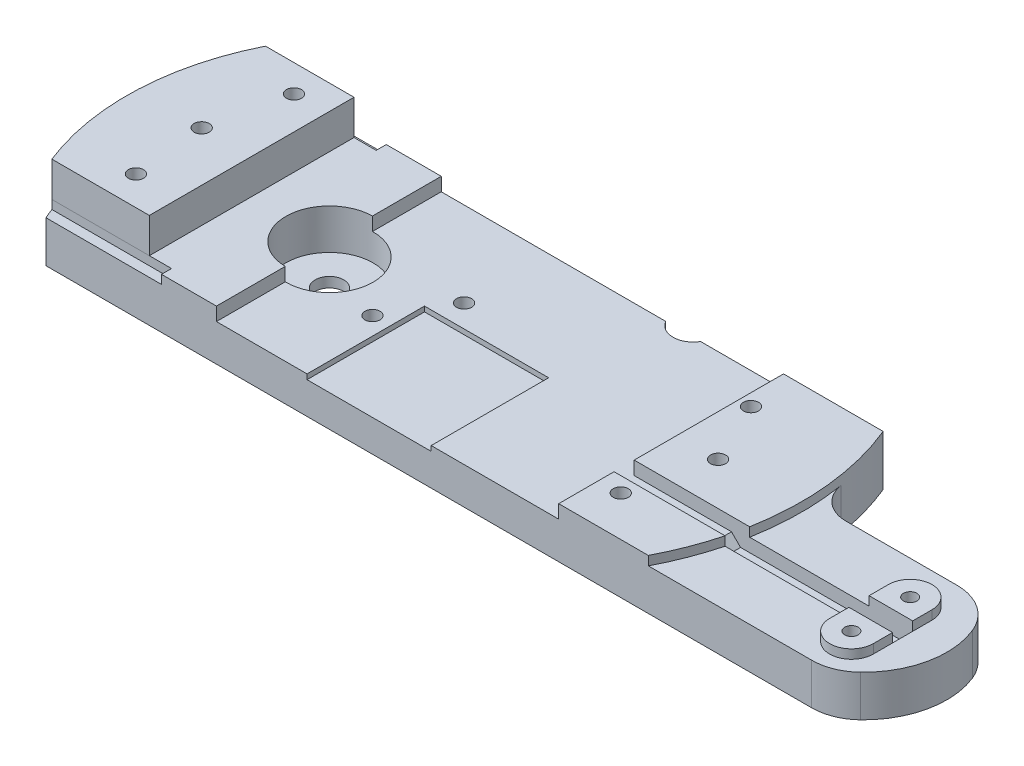
from build123d import *

# Parameters (mm, degrees)
SKETCH1_W           = 195
SKETCH1_H           = 67
BOSS_EXTRUDE1_DEPTH = 25.4
CUT_EXTRUDE1_DEPTH  = 107.177492907
CUT_EXTRUDE2_DEPTH  = 121.997561959
CUT_EXTRUDE3_START  = -13
SKETCH4_W           = 6.612655346
SKETCH4_H           = 3
CUT_EXTRUDE3_DEPTH  = 13
SKETCH6_R           = 2.25
CUT_EXTRUDE4_DEPTH  = 107.177492907
SKETCH7_W           = 37
SKETCH7_H           = 35
CUT_EXTRUDE5_DEPTH  = 1.5
CUT_EXTRUDE6_DEPTH  = 18.5
SKETCH9_R           = 2
BOSS_EXTRUDE2_DEPTH = 12.3
FILLET1_R           = 10
CUT_EXTRUDE7_REACH  = 165.895
CUT_EXTRUDE7_START  = -3
SKETCH10_R          = 13
SKETCH13_R          = 4.25
CUT_EXTRUDE9_DEPTH  = 161.89488962
SKETCH11_R          = 2
BOSS_EXTRUDE3_DEPTH = 2.7
CUT_EXTRUDE8_DEPTH  = 6


# Read off the part's stored shape, not the designer's step: Split1
with BuildPart() as part:
    # Sketch1 → Boss-Extrude1 (new body)
    with BuildSketch(Plane(origin=(0, 0, 0), x_dir=(1, 0, 0), z_dir=(0, 1, 0))):
        Rectangle(SKETCH1_W, SKETCH1_H)
    extrude(amount=BOSS_EXTRUDE1_DEPTH)

    # Sketch2 → Cut-Extrude1 (cut, through all)
    with BuildSketch(Plane.XZ):
        with BuildLine():
            Line((97.5, -3.219751644), (97.5, 33.5))
            Line((97.5, 33.5), (88.5, 33.5))
            ThreePointArc((88.5, 33.5), (95.217186872, 15.683556008), (97.5, -3.219751644))
        make_face()
        with BuildLine():
            Line((97.5, -33.5), (97.5, -3.219751644))
            ThreePointArc((97.5, -3.219751644), (95.985558513, -18.65423771), (91.5, -33.5))
            Line((91.5, -33.5), (97.5, -33.5))
        make_face()
        with BuildLine():
            ThreePointArc((-88, -33.5), (-95.08607052, -15.861694529), (-97.5, 2.992884749))
            Line((-97.5, 2.992884749), (-97.5, -33.5))
            Line((-97.5, -33.5), (-88, -33.5))
        make_face()
        with BuildLine():
            ThreePointArc((-97.5, 2.992884749), (-95.856964648, 18.588830376), (-91, 33.5))
            Line((-91, 33.5), (-97.5, 33.5))
            Line((-97.5, 33.5), (-97.5, 2.992884749))
        make_face()
    extrude(amount=-CUT_EXTRUDE1_DEPTH, mode=Mode.SUBTRACT)

    # Sketch3 → Cut-Extrude2 (cut, through all)
    with BuildSketch(Plane(origin=(0, 0, 33.5), x_dir=(-1, 0, 0), z_dir=(0, 0, -1))):
        Polygon((63.2, 25.4), (63.2, 15), (40.2, 15), (40.2, 11), (-61.8, 11), (-61.8, 15), (-97.5, 15), (-97.5, 25.4), align=None)
    extrude(amount=CUT_EXTRUDE2_DEPTH, mode=Mode.SUBTRACT)

    # Sketch4 → Cut-Extrude3 (cut)
    with BuildSketch(Plane(origin=(0, 25.4, 0), x_dir=(1, 0, 0), z_dir=(0, 1, 0)).offset(CUT_EXTRUDE3_START)):
        with BuildLine():
            Line((-63.2, 30.5), (-63.2, 33.5))
            Line((-63.2, 33.5), (-88, 33.5))
            ThreePointArc((-88, 33.5), (-88.810680862, 32.008999469), (-89.587344654, 30.5))
            Line((-89.587344654, 30.5), (-63.2, 30.5))
        make_face()
        with Locations((-59.893672327, 32)):
            Rectangle(SKETCH4_W, SKETCH4_H)
        with BuildLine():
            Line((-63.2, -33.5), (-63.2, -30.5))
            Line((-63.2, -30.5), (-92.261692194, -30.5))
            ThreePointArc((-92.261692194, -30.5), (-91.647155152, -32.006859002), (-91, -33.5))
            Line((-91, -33.5), (-63.2, -33.5))
        make_face()
        with Locations((-59.893672327, -32)):
            Rectangle(SKETCH4_W, SKETCH4_H)
    extrude(amount=CUT_EXTRUDE3_DEPTH, mode=Mode.SUBTRACT)

    # Sketch6 → Cut-Extrude4 (cut, through all)
    with BuildSketch(Plane.XZ):
        with Locations(Location((-18.5, 8.7, 0), (0, 0, 270))):
            Circle(SKETCH6_R)
        with Locations(Location((74.1, -1.7, 0), (0, 0, 270))):
            Circle(SKETCH6_R)
        with Locations(Location((68.3, 21.5, 0), (0, 0, 270))):
            Circle(SKETCH6_R)
        with Locations(Location((65.4, -20.2, 0), (0, 0, 270))):
            Circle(SKETCH6_R)
        with Locations(Location((-8.1, -8.2, 0), (0, 0, 270))):
            Circle(SKETCH6_R)
        with Locations(Location((-75.9, 21.8, 0), (0, 0, 270))):
            Circle(SKETCH6_R)
        with Locations(Location((-78, 0.1, 0), (0, 0, 270))):
            Circle(SKETCH6_R)
        with Locations(Location((-73, -22.4, 0), (0, 0, 270))):
            Circle(SKETCH6_R)
    extrude(amount=-CUT_EXTRUDE4_DEPTH, mode=Mode.SUBTRACT)

    # Sketch7 → Cut-Extrude5 (cut)
    with BuildSketch(Plane(origin=(0, 11, 0), x_dir=(1, 0, 0), z_dir=(0, 1, 0))):
        with Locations((5.3, -16)):
            Rectangle(SKETCH7_W, SKETCH7_H)
    extrude(amount=-CUT_EXTRUDE5_DEPTH, mode=Mode.SUBTRACT)

    # Sketch8 → Cut-Extrude6 (cut)
    with BuildSketch(Plane(origin=(0, 25.4, 0), x_dir=(1, 0, 0), z_dir=(0, 1, 0))):
        with BuildLine():
            Line((37.096152423, 33.5), (31.9, 33.5))
            Line((31.9, 33.5), (31.9, 30.5))
            ThreePointArc((31.9, 30.5), (34.9, 31.303847577), (37.096152423, 33.5))
        make_face()
        with BuildLine():
            Line((31.9, 33.5), (26.703847577, 33.5))
            ThreePointArc((26.703847577, 33.5), (28.9, 31.303847577), (31.9, 30.5))
            Line((31.9, 30.5), (31.9, 33.5))
        make_face()
    extrude(amount=-CUT_EXTRUDE6_DEPTH, mode=Mode.SUBTRACT)

    # Sketch9 → Boss-Extrude2 (add)
    with BuildSketch(Plane.XZ):
        with BuildLine():
            Line((88.5, 33.5), (137.200361796, 33.5))
            ThreePointArc((137.200361796, 33.5), (142.769729546, 32.427747228), (147.542861296, 29.364285714))
            ThreePointArc((147.542861296, 29.364285714), (154.743476693, 16.527679502), (153.473750823, 1.864285714))
            ThreePointArc((153.473750823, 1.864285714), (147.953179578, -4.940573023), (139.572717606, -7.5))
            Line((139.572717606, -7.5), (97.384558849, -7.5))
            ThreePointArc((97.384558849, -7.5), (95.698800641, 13.597328658), (88.5, 33.5))
        make_face()
        with Locations(Location((138.3, 5.25, 0), (0, 0, 270))):
            Circle(SKETCH9_R, mode=Mode.SUBTRACT)
        with Locations(Location((138.3, 22.75, 0), (0, 0, 270))):
            Circle(SKETCH9_R, mode=Mode.SUBTRACT)
    extrude(amount=-BOSS_EXTRUDE2_DEPTH)

    # Fillet1
    fillet1_edges = [part.edges().sort_by_distance(p)[0] for p in [
        (97.384558849, 6.15, -7.5),
    ]]
    fillet(fillet1_edges, radius=FILLET1_R)

    # Cut-Extrude7: up to this face of the body (flat: up to its plane)
    cut_extrude7_end = Plane(part.part.faces().sort_by_distance((-51.483463415, 15, 0))[0])
    # Sketch10 → Cut-Extrude7 (cut, up to the picked face)
    with BuildSketch(Plane.XZ.offset(CUT_EXTRUDE7_START), mode=Mode.PRIVATE) as cut_extrude7_sk1:
        with Locations(Location((-40.017782272, 0, 0), (0, 0, 270))):
            Circle(SKETCH10_R)
    cut_extrude7_tool1 = split(extrude(cut_extrude7_sk1.sketch, amount=-CUT_EXTRUDE7_REACH, mode=Mode.PRIVATE), bisect_by=cut_extrude7_end, keep=Keep.BOTH, mode=Mode.PRIVATE)
    add(cut_extrude7_tool1.solids().sort_by(Axis((-40.017782, 3, 0), (0, 1, 0)))[0], mode=Mode.SUBTRACT)

    # Sketch13 → Cut-Extrude9 (cut, through all)
    with BuildSketch(Plane.XZ):
        with Locations(Location((-40.017782272, 0, 0), (0, 0, 270))):
            Circle(SKETCH13_R)
    extrude(amount=-CUT_EXTRUDE9_DEPTH, mode=Mode.SUBTRACT)

    # Sketch11 → Boss-Extrude3 (add)
    # profile 1 of 2: a face of its own
    with BuildSketch(Plane(origin=(0, 12.3, 0), x_dir=(1, 0, 0), z_dir=(0, 1, 0))):
        with BuildLine():
            Line((144.8, -11), (144.8, -5.25))
            ThreePointArc((144.8, -5.25), (138.3, 1.25), (131.8, -5.25))
            Line((131.8, -5.25), (131.8, -11))
            Line((131.8, -11), (144.8, -11))
        make_face()
        with Locations(Location((138.3, -5.25, 0), (0, 0, 90))):
            Circle(SKETCH11_R, mode=Mode.SUBTRACT)
    # profile 2 of 2: a face of its own
    with BuildSketch(Plane(origin=(0, 12.3, 0), x_dir=(1, 0, 0), z_dir=(0, 1, 0))):
        with BuildLine():
            Line((144.8, -22.75), (144.8, -17))
            Line((144.8, -17), (131.8, -17))
            Line((131.8, -17), (131.8, -22.75))
            ThreePointArc((131.8, -22.75), (138.3, -29.25), (144.8, -22.75))
        make_face()
        with Locations(Location((138.3, -22.75, 0), (0, 0, 90))):
            Circle(SKETCH11_R, mode=Mode.SUBTRACT)
    extrude(amount=BOSS_EXTRUDE3_DEPTH)

    # Sketch12 → Cut-Extrude8 (cut)
    with BuildSketch(Plane.XY.offset(11)):
        Polygon((144.8, 15), (144.8, 8.3), (93.5, 8.3), (90.8, 11), (61.8, 11), (61.8, 15), align=None)
    extrude(amount=CUT_EXTRUDE8_DEPTH, mode=Mode.SUBTRACT)


with BuildPart() as body_2:
    # Split1: the piece on the far side of the plane
    add(part.part)
    split(bisect_by=Plane(origin=(0, 15, 0), x_dir=(1, 0, 0), z_dir=(0, 1, 0)), keep=Keep.BOTTOM)


with BuildPart() as part_1:
    add(part.part)

    # Split1
    split(bisect_by=Plane(origin=(0, 15, 0), x_dir=(1, 0, 0), z_dir=(0, 1, 0)), keep=Keep.TOP)


solid = Compound([body_2.part, part_1.part])
